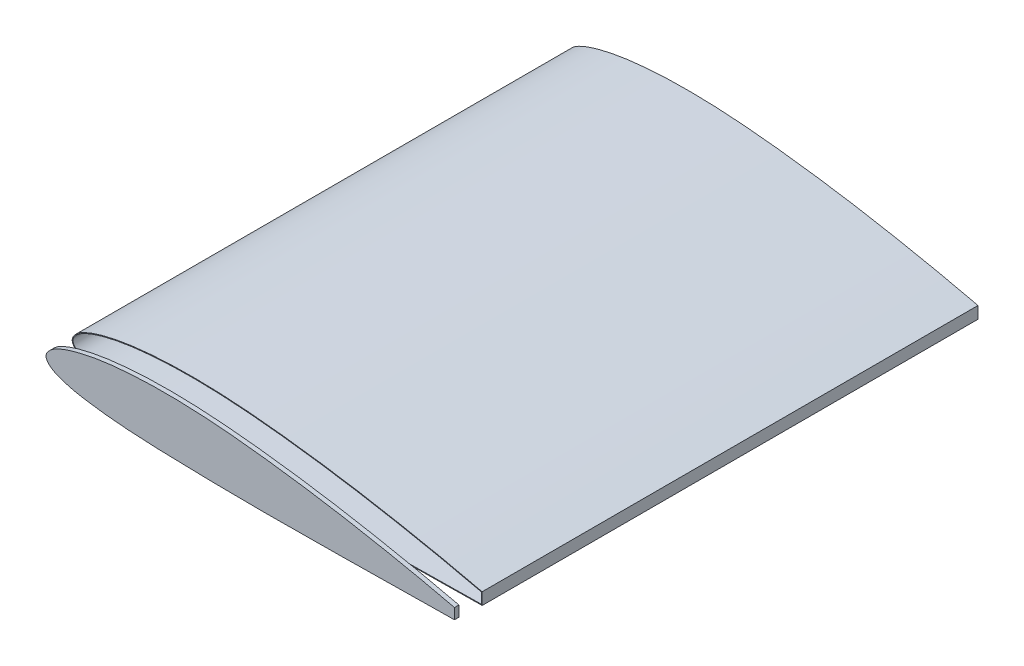
from build123d import *

# Parameters (mm, degrees)
CUT_EXTRUDE2_DEPTH      = 456.484616263
CUT_EXTRUDE2_DEPTH_BACK = 456.484616263
SKETCH12_W              = 30
SKETCH12_H              = 335.28
SHELL7_START            = 0.5
SHELL7_DEPTH            = 334.78
BOSS_EXTRUDE1_DEPTH     = 3


# Read off the part's stored shape, not the designer's step: Shell7
with BuildPart() as part:
    # Sketch3 → Loft1 section 0
    with BuildSketch(Plane.XY):
        with BuildLine():
            Line((304.402760331, -9.206309447), (307.244987748, -9.943633681))
            Line((307.244987748, -9.943633681), (304.361804056, -9.997689479))
            add(Edge.make_bspline(
                [(304.402760331, -9.206309447), (299.386393305, -7.904974812), (289.366834348, -5.305723396), (269.292243905, -0.455697423), (244.157418673, 5.067813383), (213.93952694, 11.002079852), (183.689202989, 16.212376808), (153.375306279, 20.449953668), (123.023879434, 23.827993752), (97.63872708, 25.447666722), (77.294499113, 25.657862147), (61.992767442, 25.215004112), (46.634606061, 24.054498874), (33.812510772, 22.310235655), (23.548958486, 20.117280617), (15.746504066, 18.044448787), (9.09525196, 15.503022528), (3.305842356, 12.304112273), (-1.897531204, 6.523191652), (2.90852328, 0.956438003), (8.287253401, -1.747431977), (14.665860328, -3.919971957), (22.247032639, -5.633346115), (32.352306183, -7.28367259), (44.993986957, -8.805622753), (60.209207882, -9.940944481), (75.434015323, -10.680394184), (95.75087408, -11.282701477), (121.162053183, -11.789584979), (151.674243405, -11.96213272), (182.199368639, -11.713734618), (212.733374887, -11.393730006), (243.273783293, -11.050843591), (268.724480055, -10.596509904), (289.088670203, -10.284040099), (299.270526365, -10.093144055), (304.361804056, -9.997689479)],
                knots=[0, 0, 0, 0, 0.02501249, 0.049959286, 0.099672925, 0.14920632, 0.198581097, 0.24780517, 0.296916575, 0.345952722, 0.370491626, 0.395091204, 0.419814796, 0.444798575, 0.457489819, 0.470406405, 0.483879409, 0.49126412, 0.503458853, 0.513609129, 0.520450991, 0.533235388, 0.545691039, 0.558031884, 0.582609167, 0.607134742, 0.63165208, 0.656174272, 0.705233949, 0.754320379, 0.803437364, 0.852566096, 0.901700994, 0.950848809, 0.975422717, 1, 1, 1, 1], degree=3))
        make_face()
    # Sketch4 → Loft1 section 1
    with BuildSketch(Plane.XY.offset(335.28)):
        with BuildLine():
            Line((304.361804056, -9.997689479), (307.244987748, -9.943633681))
            Line((307.244987748, -9.943633681), (304.402760331, -9.206309447))
            add(Edge.make_bspline(
                [(304.402760331, -9.206309447), (299.386393305, -7.904974812), (289.366834348, -5.305723396), (269.292243905, -0.455697423), (244.157418673, 5.067813383), (213.93952694, 11.002079852), (183.689202989, 16.212376808), (153.375306279, 20.449953668), (123.023879434, 23.827993752), (97.63872708, 25.447666722), (77.294499113, 25.657862147), (61.992767442, 25.215004112), (46.634606061, 24.054498874), (33.812510772, 22.310235655), (23.548958486, 20.117280617), (15.746504066, 18.044448787), (9.09525196, 15.503022528), (3.305842356, 12.304112273), (-1.897531204, 6.523191652), (2.90852328, 0.956438003), (8.287253401, -1.747431977), (14.665860328, -3.919971957), (22.247032639, -5.633346115), (32.352306183, -7.28367259), (44.993986957, -8.805622753), (60.209207882, -9.940944481), (75.434015323, -10.680394184), (95.75087408, -11.282701477), (121.162053183, -11.789584979), (151.674243405, -11.96213272), (182.199368639, -11.713734618), (212.733374887, -11.393730006), (243.273783293, -11.050843591), (268.724480055, -10.596509904), (289.088670203, -10.284040099), (299.270526365, -10.093144055), (304.361804056, -9.997689479)],
                knots=[0, 0, 0, 0, 0.02501249, 0.049959286, 0.099672925, 0.14920632, 0.198581097, 0.24780517, 0.296916575, 0.345952722, 0.370491626, 0.395091204, 0.419814796, 0.444798575, 0.457489819, 0.470406405, 0.483879409, 0.49126412, 0.503458853, 0.513609129, 0.520450991, 0.533235388, 0.545691039, 0.558031884, 0.582609167, 0.607134742, 0.63165208, 0.656174272, 0.705233949, 0.754320379, 0.803437364, 0.852566096, 0.901700994, 0.950848809, 0.975422717, 1, 1, 1, 1], degree=3))
        make_face()
    loft()

    # Sketch12 → Cut-Extrude2 (cut, two sides: drawn at the far end of the back side and taken through both)
    with BuildSketch(Plane(origin=(0, 0, 0), x_dir=(1, 0, 0), z_dir=(0, 1, 0)).offset(-CUT_EXTRUDE2_DEPTH_BACK)):
        with Locations((292.244987748, -167.64)):
            Rectangle(SKETCH12_W, SKETCH12_H)
    extrude(amount=CUT_EXTRUDE2_DEPTH + CUT_EXTRUDE2_DEPTH_BACK, mode=Mode.SUBTRACT)

    # Shell7 outline → Shell7 (cut)
    with BuildSketch(Plane.XY.offset(SHELL7_START)):
        with BuildLine():
            Line((276.7449878, -9.975467396), (276.744987767, -2.791972072))
            add(Edge.make_bspline(
                [(276.744987767, -2.791972072), (276.682381822, -2.77714937), (276.619774909, -2.762330556), (276.557167031, -2.747515623), (276.49455819, -2.732704564), (276.431948388, -2.717897371), (276.369337629, -2.703094037), (276.306725915, -2.688294555), (276.244113248, -2.673498916), (276.181499631, -2.658707113), (276.118885067, -2.64391914), (276.056269558, -2.629134989), (275.993653107, -2.614354651), (275.931035716, -2.599578121), (275.189834715, -2.424716171), (274.511146145, -2.265075559), (273.832352143, -2.105882969), (273.153453155, -1.947137816), (272.474449628, -1.788839507), (271.795341984, -1.630987447), (271.116130656, -1.473581036), (270.436816037, -1.316619668), (269.757398544, -1.160102735), (269.077878552, -1.004029623), (268.39825645, -0.848399714), (267.718532601, -0.693212386), (267.038707367, -0.538467013), (264.99892855, -0.075554861), (263.638667103, 0.231288694), (262.278004991, 0.536401658), (260.916951774, 0.839795721), (259.555513103, 1.141493569), (258.19369551, 1.441527482), (256.831509337, 1.739928213), (255.468966538, 2.036717327), (254.106075936, 2.331907333), (252.742840405, 2.625507782), (251.37925974, 2.917532273), (250.015338238, 3.208000767), (248.65108861, 3.496933953), (245.921936627, 4.071749126), (244.557033381, 4.357629703), (243.191832895, 4.642003994), (241.826246605, 4.924813259), (240.460451184, 5.206235641), (239.094283435, 5.486027554), (237.727761756, 5.764326773), (236.361016769, 6.041304748), (234.993981327, 6.316726392), (233.626583059, 6.590510755), (232.258937704, 6.862950098), (230.890967514, 7.133764038), (229.522707225, 7.403071115), (226.785580944, 7.938590141), (225.416711631, 8.204806415), (224.04756769, 8.469496385), (222.678050319, 8.732586822), (221.308352104, 8.994282318), (219.938295343, 9.254277055), (218.567891227, 9.512746065), (217.197285671, 9.769885929), (215.826414998, 10.025384779), (214.455185959, 10.279152077), (213.083712014, 10.53155744), (211.711944854, 10.782206542), (210.339880008, 11.031279107), (207.595176489, 11.526112837), (206.22253655, 11.771880072), (204.849605802, 12.015964787), (203.476381022, 12.258336251), (202.102858793, 12.498964571), (200.729035841, 12.737819683), (199.354909172, 12.974870662), (197.98047622, 13.210085335), (196.60573473, 13.443430214), (195.230682684, 13.674870736), (193.855317976, 13.904371816), (192.479638078, 14.131898718), (191.103639521, 14.357418229), (188.350995097, 14.804382072), (186.974339913, 15.025831314), (185.597439726, 15.245220441), (184.219833289, 15.462518684), (182.843076001, 15.677992099), (181.463512061, 15.890265362), (180.087368521, 16.103061286), (178.706905986, 16.309540968), (177.32912378, 16.518134565), (175.949387966, 16.721686702), (174.56998207, 16.924598778), (173.190095226, 17.124954953), (171.809938007, 17.323365929), (169.049031329, 17.716094107), (167.668283755, 17.910427758), (166.287251353, 18.102707442), (164.905921109, 18.293051584), (163.524336344, 18.481333013), (162.142467776, 18.667619112), (160.760306951, 18.852007871), (159.377903158, 19.034452005), (157.995272229, 19.214891124), (156.612361944, 19.393391138), (155.229173447, 19.569990139), (153.845800639, 19.744563486), (152.462125672, 19.917262054), (149.694362442, 20.258706043), (148.310259018, 20.427449501), (146.925937206, 20.594139591), (145.54137113, 20.758689017), (144.156572312, 20.921039557), (142.771542148, 21.081110982), (141.386260438, 21.238805222), (140.000710569, 21.39404361), (138.614897557, 21.546778783), (137.228834739, 21.696962956), (135.842517657, 21.84451358), (134.455928193, 21.98933842), (133.069077642, 22.13140762), (130.294847623, 22.409858269), (128.907468508, 22.546247633), (127.519830815, 22.679693669), (126.131912708, 22.810225231), (124.74375953, 22.937635502), (123.355336802, 23.061896697), (121.966620722, 23.183028436), (120.577654686, 23.300912397), (119.188468514, 23.415383727), (117.799021316, 23.526385321), (116.409294002, 23.633887203), (115.019359552, 23.737729841), (113.629161602, 23.837864675), (110.848296789, 24.030519303), (109.457628313, 24.123040472), (108.066724821, 24.211664691), (106.675601898, 24.296302576), (105.284266379, 24.376867532), (103.892719782, 24.453269113), (102.500966283, 24.525412901), (101.109015924, 24.593207247), (99.716882523, 24.656569588), (98.324580257, 24.715424021), (96.932123201, 24.769687259), (95.539528204, 24.819252246), (94.146813387, 24.863997246), (91.361131065, 24.943749754), (89.968170951, 24.978753029), (88.575081034, 25.008866448), (87.182009149, 25.033855176), (85.788617395, 25.054119462), (84.39555622, 25.068761697), (83.002092792, 25.078786239), (81.608742383, 25.083484342), (80.215683022, 25.082433377), (78.822054929, 25.076859354), (77.42903628, 25.065510238), (76.035841536, 25.048812032), (74.64281958, 25.026599003), (72.553498722, 24.984836089), (71.85709509, 24.969507989), (71.160731608, 24.952759909), (70.464411739, 24.934577807), (69.768138878, 24.914947364), (69.071916371, 24.893854652), (68.375747529, 24.87128655), (67.679635719, 24.847230901), (66.983584428, 24.821676426), (66.287597422, 24.794612382), (65.591678876, 24.766027968), (64.895833578, 24.735911479), (64.200067139, 24.704249214), (62.808705347, 24.637799032), (62.113111183, 24.603006939), (61.417595998, 24.566652447), (60.722198095, 24.528678398), (60.026886435, 24.489091914), (59.331657417, 24.447899903), (58.636548968, 24.4050733), (57.941586242, 24.360567025), (57.246753413, 24.314350501), (56.552031795, 24.266409449), (55.857449583, 24.216721974), (55.163047611, 24.16524848), (54.468772343, 24.111964085), (53.080540746, 24.00175962), (52.386578158, 23.944833558), (51.692794339, 23.886109889), (50.999141966, 23.825317603), (50.305607525, 23.763375904), (49.612872454, 23.69788499), (48.918421566, 23.633103608), (48.227527693, 23.56366104), (47.533087625, 23.494098489), (46.84177803, 23.421739471), (46.149227716, 23.347390593), (45.457358472, 23.271066755), (44.765722408, 23.192564466), (43.383068537, 23.031124655), (42.692050046, 22.948184555), (42.001347555, 22.862947058), (41.310993872, 22.775349228), (40.621003985, 22.685312831), (39.931383995, 22.592756263), (39.242147392, 22.497608355), (38.553319898, 22.399809391), (37.864932008, 22.299301402), (37.17700824, 22.19601812), (36.489564092, 22.089885149), (35.802615576, 21.980832618), (35.116192229, 21.868806139), (34.08738754, 21.696202486), (33.744584777, 21.637908026), (33.401976065, 21.578842228), (33.059301862, 21.519007128), (32.717293807, 21.458385927), (32.374619181, 21.396943144), (32.032861564, 21.334777304), (31.691114246, 21.271721939), (31.348844264, 21.207836639), (31.007822087, 21.143289415), (30.666170913, 21.077684845), (30.324984011, 21.011376135), (29.983882687, 20.944209499), (29.302007297, 20.808250857), (28.961224521, 20.739456194), (28.620610859, 20.669842666), (28.280130201, 20.599428637), (27.939822015, 20.528220242), (27.599705343, 20.456212392), (27.259757666, 20.383400317), (26.919963438, 20.309785693), (26.580343493, 20.235372933), (26.240922978, 20.16016157), (25.901684152, 20.084145429), (25.562592914, 20.007324396), (25.223696443, 19.929715667), (24.715615224, 19.812113581), (24.546310645, 19.772717118), (24.376942027, 19.733101959), (24.20814501, 19.693402936), (24.037781339, 19.653124492), (23.870867227, 19.613554265), (23.698908614, 19.57225401), (23.532376692, 19.532625913), (23.361872144, 19.491200817), (23.193642495, 19.450556495), (23.02460019, 19.409261208), (22.855870285, 19.367887341), (22.687165999, 19.326264263), (22.349906971, 19.242569549), (22.181348505, 19.200495218), (22.012862586, 19.158188471), (21.844450781, 19.115643886), (21.67611472, 19.072856065), (21.507856099, 19.029819634), (21.339676677, 18.986529239), (21.17157828, 18.942979549), (21.003562797, 18.899165257), (20.835632182, 18.855081076), (20.667788454, 18.810721744), (20.500033698, 18.76608202), (20.332370061, 18.721156685), (19.829659149, 18.585508263), (19.494887581, 18.493910643), (19.160515283, 18.401114849), (18.826544517, 18.307064591), (18.492984452, 18.211718026), (18.159854739, 18.11504403), (17.82717811, 18.017010512), (17.494973682, 17.917579478), (17.163255784, 17.816710374), (16.832038082, 17.714365965), (16.501339432, 17.610513552), (16.171186422, 17.505118692), (15.841607792, 17.398138831), (15.348123082, 17.235241053), (15.183776531, 17.180537256), (15.019580009, 17.125423737), (14.85553585, 17.069895907), (14.691646917, 17.013949464), (14.527916486, 16.957580141), (14.364348131, 16.90078353), (14.200945616, 16.843554971), (14.037712795, 16.785889505), (13.874653507, 16.727781907), (13.711771492, 16.669226771), (13.5490703, 16.610218673), (13.386553207, 16.550752403), (13.06189308, 16.430894109), (12.89975372, 16.370502785), (12.737790137, 16.309638627), (12.576044012, 16.248309708), (12.414492515, 16.186498604), (12.253121622, 16.124196289), (12.091953415, 16.061408536), (11.931014385, 15.998137153), (11.770305617, 15.934368472), (11.609814254, 15.87008494), (11.449546887, 15.805283667), (11.289527707, 15.739969553), (11.129745424, 15.674121395), (10.810677377, 15.541355282), (10.65137679, 15.474432425), (10.492471105, 15.40700743), (10.333102744, 15.338813154), (10.176357258, 15.270821165), (10.014403364, 15.200392886), (9.862089009, 15.132793102), (9.698061875, 15.060007288), (9.545962428, 14.991311687), (9.385386161, 14.918408314), (9.230119495, 14.847068426), (9.073041691, 14.774193592), (8.916759339, 14.700993251), (8.682854965, 14.590286119), (8.604976533, 14.553234968), (8.527242236, 14.516056547), (8.449427178, 14.478634868), (8.372143797, 14.44126882), (8.294311924, 14.403411377), (8.217169198, 14.365688305), (8.140040777, 14.327735817), (8.062496387, 14.289346615), (7.985889407, 14.251211174), (7.908770205, 14.212542962), (7.832002083, 14.173838424), (7.755354625, 14.134929998), (7.602361916, 14.056736764), (7.526013319, 14.017448694), (7.449845145, 13.977977822), (7.373768267, 13.938258452), (7.297971153, 13.898396702), (7.222265335, 13.858260411), (7.146707706, 13.817880542), (7.071435443, 13.777329521), (6.996317413, 13.736505647), (6.921296936, 13.695372731), (6.846595185, 13.654066781), (6.772072449, 13.612455435), (6.697716239, 13.570556089), (6.549404292, 13.486189673), (6.475443627, 13.443720608), (6.401676329, 13.40095986), (6.328121599, 13.357909376), (6.254768676, 13.314559097), (6.181620764, 13.270905642), (6.108695243, 13.226951071), (6.035997345, 13.182691243), (5.963515677, 13.138115196), (5.891249919, 13.09321844), (5.819229252, 13.048009856), (5.747470059, 13.002489464), (5.675908759, 12.956618449), (5.533262752, 12.864219576), (5.462170372, 12.817686745), (5.391317654, 12.770822976), (5.320699589, 12.723622176), (5.250322065, 12.676085065), (5.180193895, 12.628214023), (5.110318024, 12.580007683), (5.040692567, 12.531461791), (4.971318452, 12.482574089), (4.902204419, 12.433347248), (4.833361615, 12.383785043), (4.764789327, 12.33388322), (4.69647031, 12.283627624), (4.56036732, 12.182429116), (4.492576262, 12.131480581), (4.425097023, 12.080219565), (4.357713887, 12.028482299), (4.291034437, 11.976727544), (4.223944086, 11.924100821), (4.157794211, 11.871648889), (4.091750518, 11.818703552), (4.025448024, 11.765002579), (3.960414049, 11.711737082), (3.894809195, 11.657423015), (3.829902282, 11.60312226), (3.765227628, 11.548414813), (3.636548282, 11.438358309), (3.572538106, 11.383003883), (3.508840224, 11.327297834), (3.445546927, 11.271319159), (3.382493563, 11.214900078), (3.319879638, 11.158226371), (3.257644531, 11.101225532), (3.195675323, 11.043781085), (3.134132731, 10.986045444), (3.073056102, 10.92803979), (3.012221108, 10.869532013), (2.951858173, 10.810760923), (2.891901976, 10.751627311), (2.802605046, 10.662401372), (2.772945739, 10.632571642), (2.743393961, 10.602653706), (2.713950903, 10.572647114), (2.684617759, 10.54255141), (2.655395721, 10.512366142), (2.626285982, 10.482090856), (2.597289733, 10.4517251), (2.568408167, 10.421268419), (2.539642477, 10.390720361), (2.510993855, 10.360080471), (2.482463494, 10.329348297), (2.454052585, 10.298523386), (2.397472057, 10.236687181), (2.369298272, 10.205670998), (2.341279531, 10.174600613), (2.313258582, 10.143286529), (2.285641977, 10.112216172), (2.257766554, 10.080579221), (2.230284185, 10.049187181), (2.202992475, 10.017758333), (2.175506904, 9.985835666), (2.148430482, 9.954190597), (2.121400084, 9.922307483), (2.094518428, 9.890360131), (2.067788297, 9.858325812), (2.014621245, 9.794075263), (1.988185866, 9.761860172), (1.96190108, 9.729554732), (1.935769331, 9.697158412), (1.909793063, 9.664670681), (1.88397472, 9.632091006), (1.858316748, 9.599418856), (1.832821589, 9.5666537), (1.80749169, 9.533795006), (1.782329494, 9.500842242), (1.757337446, 9.467794877), (1.732517989, 9.434652378), (1.707873569, 9.401414215), (1.658939691, 9.334745497), (1.634651874, 9.301317343), (1.61053359, 9.267778147), (1.586621868, 9.234176136), (1.56286907, 9.200439366), (1.539301943, 9.166603493), (1.515949922, 9.132705808), (1.492784178, 9.098699377), (1.469782352, 9.064549687), (1.446985563, 9.030314903), (1.42442349, 8.996031614), (1.402042112, 8.96161175), (1.379881397, 8.927113479), (1.335985835, 8.857923601), (1.314252405, 8.823234384), (1.292736751, 8.788450946), (1.271442276, 8.753573329), (1.250372361, 8.718601566), (1.229530367, 8.683535676), (1.208919633, 8.648375666), (1.188543477, 8.613121533), (1.168405197, 8.577773259), (1.148508069, 8.542330816), (1.128855349, 8.506794165), (1.109450269, 8.471163251), (1.090296043, 8.435438012), (1.061945772, 8.381708549), (1.052559207, 8.363775139), (1.043236559, 8.345818121), (1.033978219, 8.327837477), (1.024784579, 8.309833186), (1.015656029, 8.29180523), (1.006592961, 8.27375359), (0.997595767, 8.255678246), (0.988664837, 8.237579181), (0.979800562, 8.219456374), (0.971003335, 8.201309806), (0.962273546, 8.18313946), (0.953611586, 8.164945315), (0.936424108, 8.128509389), (0.927898549, 8.110267741), (0.919442879, 8.092004355), (0.911052814, 8.073710201), (0.902731414, 8.055391333), (0.894484336, 8.037058463), (0.886313927, 8.018714839), (0.87821848, 8.000355158), (0.870195883, 7.981973537), (0.862247354, 7.963571377), (0.854377011, 7.945156194), (0.846586567, 7.926730165), (0.838871599, 7.908282314), (0.815966275, 7.852897823), (0.801012224, 7.815913007), (0.786380591, 7.778868885), (0.772077559, 7.741767922), (0.758109235, 7.704612524), (0.744481652, 7.667405044), (0.731200771, 7.630147778), (0.718272479, 7.592842968), (0.70570259, 7.555492801), (0.693496844, 7.518099407), (0.681660907, 7.480664863), (0.670200372, 7.443191189), (0.65912076, 7.40568035), (0.643080894, 7.34936121), (0.637830908, 7.330579407), (0.632678216, 7.311789039), (0.627623476, 7.292990295), (0.622667346, 7.274183367), (0.617810484, 7.255368446), (0.613053547, 7.236545722), (0.608397195, 7.217715386), (0.603842085, 7.198877629), (0.599388875, 7.18003264), (0.595038223, 7.161180612), (0.590790786, 7.142321735), (0.586647224, 7.123456199), (0.578569163, 7.085712191), (0.574635388, 7.066838149), (0.57080324, 7.047935364), (0.567079844, 7.0290556), (0.563474426, 7.010207766), (0.559953049, 6.991244292), (0.556535013, 6.97226644), (0.553241722, 6.953363784), (0.550045452, 6.934401757), (0.546940605, 6.915361095), (0.543964685, 6.896415433), (0.541080592, 6.877386735), (0.538308554, 6.858372251), (0.530312092, 6.801288567), (0.525410396, 6.76319414), (0.520940738, 6.725068797), (0.51690581, 6.686920204), (0.513308246, 6.648755971), (0.510150615, 6.610583651), (0.507435426, 6.572410744), (0.505165125, 6.534244691), (0.503342096, 6.496092878), (0.501968659, 6.457962635), (0.501047076, 6.419861237), (0.500579542, 6.381795901), (0.500568193, 6.343773791), (0.501238558, 6.286816124), (0.501576612, 6.267842869), (0.502029511, 6.248883097), (0.502597501, 6.229937659), (0.503280828, 6.211007403), (0.504079736, 6.192093179), (0.504994472, 6.173195838), (0.506025282, 6.154316228), (0.50717241, 6.135455199), (0.508436103, 6.1166136), (0.509816606, 6.097792282), (0.511314166, 6.078992094), (0.512929026, 6.060213885), (0.515527638, 6.032080815), (0.516423093, 6.022710305), (0.51734899, 6.013334528), (0.518300991, 6.00399827), (0.519287295, 5.994621948), (0.520302124, 5.985258499), (0.521341192, 5.975951507), (0.522411799, 5.966635509), (0.523518827, 5.95726243), (0.524654506, 5.947900363), (0.525814489, 5.938590058), (0.527010885, 5.929221944), (0.528234466, 5.919877003), (0.530742392, 5.901175961), (0.53202625, 5.891824129), (0.533339915, 5.882471039), (0.5346833, 5.873116744), (0.536056317, 5.863761299), (0.537458878, 5.854404755), (0.538890895, 5.845047168), (0.540352282, 5.83568859), (0.541842949, 5.826329075), (0.543362809, 5.816968677), (0.544911775, 5.807607448), (0.546489759, 5.798245443), (0.548096673, 5.788882714), (0.556275455, 5.742065723), (0.563279879, 5.7046014), (0.57073999, 5.667130198), (0.578649965, 5.629656077), (0.587003865, 5.592183111), (0.595795642, 5.554715487), (0.605019133, 5.5172575), (0.614668064, 5.479813562), (0.624736045, 5.442388192), (0.635216576, 5.404986025), (0.646103044, 5.367611806), (0.657388722, 5.330270391), (0.669066772, 5.292966751), (0.687161977, 5.237075572), (0.693290136, 5.218455833), (0.699513816, 5.19984738), (0.70583211, 5.181250844), (0.712244115, 5.162666856), (0.718748925, 5.144096049), (0.725345636, 5.125539053), (0.732033342, 5.106996501), (0.738811139, 5.088469023), (0.745678122, 5.069957251), (0.752633386, 5.051461817), (0.759676026, 5.032983353), (0.766805138, 5.01452249), (0.781234495, 4.977637228), (0.788533809, 4.959215057), (0.795920326, 4.940805211), (0.803389881, 4.922415999), (0.810939, 4.904054487), (0.818566769, 4.885721869), (0.826273933, 4.867415428), (0.834061239, 4.849132345), (0.841928356, 4.830872249), (0.849873937, 4.812637131), (0.857896691, 4.794428905), (0.865996605, 4.776246585), (0.874174718, 4.758086747), (0.898937953, 4.703684338), (0.915753519, 4.667515382), (0.932872222, 4.631445501), (0.950290425, 4.595474484), (0.968004456, 4.559602152), (0.986010613, 4.523828356), (1.00430516, 4.488152979), (1.022884328, 4.452575933), (1.041744317, 4.417097162), (1.060881294, 4.381716642), (1.080291394, 4.346434376), (1.099970718, 4.311250403), (1.119915335, 4.276164789), (1.160327233, 4.206190475), (1.180795569, 4.171299601), (1.201510324, 4.136528284), (1.222531923, 4.101757201), (1.24364515, 4.067363926), (1.265300746, 4.032561939), (1.286864863, 3.998405435), (1.308780131, 3.964182389), (1.331202846, 3.929592935), (1.353361565, 3.895893934), (1.376114099, 3.861719336), (1.398916989, 3.827912247), (1.42197828, 3.794147859), (1.468514653, 3.726852892), (1.491995141, 3.693314313), (1.515685112, 3.659884476), (1.53958175, 3.626563218), (1.563682236, 3.593350376), (1.587983752, 3.560245787), (1.612483481, 3.527249288), (1.637178605, 3.494360716), (1.662066306, 3.461579909), (1.687143766, 3.428906704), (1.712408169, 3.396340937), (1.737856695, 3.363882446), (1.763486527, 3.331531068), (1.815103168, 3.267042211), (1.841089933, 3.234904197), (1.867248556, 3.202880893), (1.89360694, 3.170918326), (1.92003126, 3.139215916), (1.946855629, 3.107301562), (1.973539442, 3.075881757), (2.000527217, 3.044408031), (2.027900691, 3.012734625), (2.054950327, 2.981759196), (2.082531273, 2.950436526), (2.110079426, 2.919438683), (2.137820132, 2.888498002), (2.193576401, 2.82685564), (2.221597925, 2.796147083), (2.24976151, 2.765550682), (2.278065827, 2.735065966), (2.306509547, 2.704692466), (2.335091341, 2.674429713), (2.363809879, 2.644277235), (2.392663833, 2.614234565), (2.421651873, 2.584301232), (2.450772671, 2.554476767), (2.480024897, 2.5247607), (2.509407222, 2.495152561), (2.538918318, 2.465651881), (2.598195392, 2.406864499), (2.627957722, 2.377581317), (2.657871516, 2.34838017), (2.687830232, 2.31936127), (2.718047206, 2.290321033), (2.748281897, 2.261481041), (2.778602594, 2.232781711), (2.809173399, 2.204066129), (2.83982569, 2.175481706), (2.870474568, 2.147111598), (2.901358056, 2.118743527), (2.932287362, 2.090538318), (2.963341359, 2.062430511), (3.056818616, 1.978444333), (3.119565052, 1.922897187), (3.182733452, 1.86779491), (3.246317598, 1.813138532), (3.310311222, 1.758929055), (3.374707941, 1.705167573), (3.439501239, 1.651855313), (3.504684512, 1.59899361), (3.570251162, 1.546583812), (3.636194761, 1.494627125), (3.702509253, 1.443124371), (3.76918923, 1.392075698), (3.836230253, 1.341480207), (3.937328728, 1.266263168), (3.971117459, 1.241303759), (4.004994798, 1.216457228), (4.038960114, 1.191723516), (4.073012775, 1.167102565), (4.107152151, 1.142594314), (4.141377611, 1.118198705), (4.175688522, 1.09391568), (4.210084254, 1.069745178), (4.244564176, 1.045687142), (4.279127656, 1.021741512), (4.313774063, 0.997908229), (4.348502766, 0.974187233), (4.418123502, 0.926969701), (4.453014201, 0.903474221), (4.487992994, 0.880085491), (4.523038256, 0.856819049), (4.558170735, 0.833659798), (4.593393397, 0.810604332), (4.628685773, 0.787666262), (4.664040076, 0.764851472), (4.699476805, 0.742146124), (4.735015587, 0.719535366), (4.770640173, 0.697027611), (4.806322614, 0.67464016), (4.842098432, 0.652349411), (4.949652321, 0.585796734), (5.021660476, 0.541852001), (5.094056677, 0.498273488), (5.166357005, 0.455332279), (5.24019316, 0.41208091), (5.31152378, 0.370811126), (5.387792354, 0.327325776), (5.45844824, 0.287462088), (5.534944891, 0.24499051), (5.607854269, 0.204879835), (5.682789205, 0.164280401), (5.757485679, 0.124257269), (5.832521532, 0.08454109), (5.983077708, 0.005772706), (6.058598431, -0.033279), (6.134409198, -0.072032743), (6.210270383, -0.110399334), (6.286779619, -0.148644485), (6.362907136, -0.186360757), (6.439717063, -0.223973883), (6.516753917, -0.261355601), (6.593477683, -0.298273885), (6.670978039, -0.335144514), (6.748387697, -0.37173735), (6.825976572, -0.408068211), (6.903739306, -0.444194181), (7.020605695, -0.498056232), (7.059599252, -0.515956537), (7.09863035, -0.533804168), (7.137698435, -0.551600161), (7.176802953, -0.569345556), (7.215943349, -0.58704139), (7.25511907, -0.6046887), (7.294329563, -0.622288524), (7.333574271, -0.639841899), (7.372852643, -0.657349865), (7.412164124, -0.674813457), (7.451508161, -0.692233714), (7.490884198, -0.709611674), (7.569699166, -0.744285074), (7.609131052, -0.761577549), (7.648650559, -0.778853549), (7.687987385, -0.796002657), (7.727824488, -0.813303119), (7.76706869, -0.830325487), (7.806727798, -0.84744629), (7.846570857, -0.86461031), (7.885958229, -0.881560041), (7.925720528, -0.898581136), (7.965362793, -0.91553567), (8.005044076, -0.932446861), (8.04474391, -0.949323147), (8.163890736, -0.999831955), (8.24338849, -1.033347405), (8.32295379, -1.066707041), (8.402584498, -1.099909525), (8.482280064, -1.132954537), (8.562041395, -1.165842913), (8.641869066, -1.198575479), (8.72176206, -1.231152062), (8.801718082, -1.263571493), (8.881735487, -1.2958327), (8.961815684, -1.327936322), (9.041963889, -1.359885585), (9.122184962, -1.391684475), (9.282755008, -1.454976668), (9.363106323, -1.486470844), (9.443523231, -1.517814073), (9.524005029, -1.549007333), (9.604551018, -1.580051598), (9.685160497, -1.610947844), (9.765832765, -1.641697047), (9.846567122, -1.672300183), (9.927362866, -1.702758227), (10.008219297, -1.733072155), (10.089135715, -1.763242942), (10.170111418, -1.793271565), (10.251145707, -1.823158999), (10.65660657, -1.9718951), (10.981910852, -2.088639401), (11.308023972, -2.203225426), (11.635171559, -2.315523922), (11.96308458, -2.426451951), (12.290545179, -2.533769332), (12.621865305, -2.641460223), (12.949292131, -2.744745691), (13.281869496, -2.847989112), (13.612058878, -2.948457806), (13.944213104, -3.04745917), (14.276524709, -3.144623196), (14.609470408, -3.240081458), (15.276409031, -3.427641572), (15.610416203, -3.519747651), (15.944871962, -3.610191757), (16.280050919, -3.699116657), (16.615212708, -3.786367827), (16.951301619, -3.872207847), (17.287540478, -3.956415952), (17.624171228, -4.039202659), (17.96148655, -4.120650361), (18.298720423, -4.200458914), (18.636736578, -4.279071175), (18.974906856, -4.356271827), (19.313479929, -4.432195894), (19.991271066, -4.581525791), (20.330498485, -4.654937021), (20.67002222, -4.727107647), (21.009928436, -4.798166684), (21.349946798, -4.867982413), (21.690393846, -4.936759305), (22.031112662, -5.004492321), (22.371911016, -5.071101033), (22.713075393, -5.13673784), (23.054602898, -5.201499367), (23.396050976, -5.265242639), (23.737896732, -5.328110485), (24.0798737, -5.390089924), (24.764222875, -5.512340898), (25.106585617, -5.572612371), (25.449128708, -5.632055817), (25.791845601, -5.690698805), (26.134730341, -5.748569893), (26.477777061, -5.805698139), (26.820979656, -5.862112698), (27.164331624, -5.917842526), (27.50782608, -5.972916169), (27.851455945, -6.02736165), (28.195214304, -6.081206455), (28.539094935, -6.134477611), (28.883093011, -6.187201858), (29.399262456, -6.265507949), (29.571345374, -6.291478706), (29.743471044, -6.317330443), (29.915579006, -6.343042318), (30.08776923, -6.368646945), (30.259990865, -6.394144632), (30.432176219, -6.419518127), (30.604371894, -6.44476893), (30.776632585, -6.469908822), (30.948906724, -6.494934649), (31.121151211, -6.519837691), (31.293459261, -6.544628601), (31.465764581, -6.569302124), (31.810416051, -6.618417667), (31.98275862, -6.642859459), (32.15511802, -6.667185456), (32.327494235, -6.691395862), (32.499887234, -6.715490899), (32.672296975, -6.739470804), (32.844723394, -6.763335835), (33.017166425, -6.787086266), (33.189625975, -6.81072239), (33.36210195, -6.834244516), (33.534594231, -6.857652973), (33.707102691, -6.880948105), (33.879627188, -6.904130276), (34.742329074, -7.019478232), (35.432746685, -7.109955942), (36.12340462, -7.198645308), (36.814308726, -7.285575552), (37.505447177, -7.370768635), (38.19680239, -7.454240232), (38.888365752, -7.536005734), (39.580137974, -7.616082593), (40.272118437, -7.694488264), (40.964296401, -7.771237327), (41.656655807, -7.846342224), (42.34919321, -7.919819279), (43.041925536, -7.991695432), (44.42773544, -8.132307083), (45.120812784, -8.201042311), (45.814073125, -8.268220878), (46.507482274, -8.33389993), (47.201040661, -8.398071572), (47.894759723, -8.460748729), (48.58863838, -8.521987749), (49.282663627, -8.581846301), (49.976823286, -8.640351203), (50.671113153, -8.697517591), (51.365532001, -8.753388693), (52.060073067, -8.808025091), (52.754726701, -8.86143412), (54.144258661, -8.965894992), (54.839130702, -9.016942371), (55.534146673, -9.066858076), (56.229146176, -9.115633115), (56.924443805, -9.163365715), (57.619680067, -9.210066892), (58.314958812, -9.255742206), (59.0104948, -9.300448785), (59.706025729, -9.344225754), (60.401496736, -9.387063956), (61.097293945, -9.429004948), (61.792987822, -9.470158868), (62.488780259, -9.510432852), (63.880463053, -9.5893182), (64.576359077, -9.62792413), (65.272305795, -9.665704128), (65.968302011, -9.702666773), (66.664347565, -9.738821283), (67.360442272, -9.774178844), (68.056585412, -9.808752768), (68.752775604, -9.842557867), (69.449010979, -9.87560942), (70.145289476, -9.907922129), (70.841609177, -9.939509428), (71.537968518, -9.970383547), (72.234366277, -10.000556701), (73.627236096, -10.059530884), (74.323704262, -10.088332094), (75.020224922, -10.116452637), (75.716759684, -10.143931318), (76.413322604, -10.170749457), (77.10993438, -10.196912051), (77.806592649, -10.222464419), (78.503283452, -10.247449599), (79.200002302, -10.271879748), (79.896756053, -10.295758436), (80.593546714, -10.319119487), (81.290364768, -10.342011366), (81.987210287, -10.364423679), (83.380958057, -10.408363333), (84.077856986, -10.429885814), (84.774802178, -10.451001074), (85.471709944, -10.471668114), (86.168759138, -10.492036426), (86.865718241, -10.511986662), (87.562707357, -10.531582859), (88.259845012, -10.550948495), (88.956898862, -10.570005318), (89.653889576, -10.58872259), (90.351142263, -10.607286197), (91.048220431, -10.625638255), (91.745360172, -10.643750081), (93.836774713, -10.697423734), (95.231074023, -10.732307459), (96.625394762, -10.766298216), (98.019735533, -10.799389998), (99.41409543, -10.831573499), (100.808474085, -10.862840671), (102.202871458, -10.893186308), (103.59728756, -10.922607553), (104.991722106, -10.951102236), (106.386174345, -10.978666949), (107.780643039, -11.005295757), (109.175126816, -11.030980454), (110.569624932, -11.055713269), (113.358652243, -11.103272578), (114.753180984, -11.126096208), (116.147723694, -11.147964878), (117.542279463, -11.168871083), (118.936847806, -11.188806221), (120.331428629, -11.207764391), (121.726021993, -11.225743391), (123.120627845, -11.242743851), (124.515245732, -11.258767392), (125.909874708, -11.273814718), (127.304513421, -11.287884553), (128.699160598, -11.30097433), (130.093815933, -11.313083526), (132.883147163, -11.335357618), (134.27781971, -11.345518221), (135.672511751, -11.354726871), (137.067191705, -11.362950375), (138.461887214, -11.370213644), (139.856605002, -11.376543061), (141.2513196, -11.381932472), (142.646018022, -11.386360372), (144.040720384, -11.389819571), (145.435444811, -11.392320746), (146.830166818, -11.393866761), (148.224855779, -11.39443366), (149.619572124, -11.39400481), (152.409019539, -11.391305012), (153.803752752, -11.389029349), (155.198491342, -11.385839647), (156.59324602, -11.381808185), (157.988002822, -11.376945259), (159.382758365, -11.3712595), (160.777525114, -11.364794164), (162.172311394, -11.357610678), (163.567109784, -11.349759385), (164.961909738, -11.341274452), (166.356716452, -11.332193064), (167.751542458, -11.322566068), (169.146371805, -11.312436078), (171.936054022, -11.291258663), (173.330903423, -11.280219906), (174.725772611, -11.268706595), (176.120641194, -11.257017832), (177.515498916, -11.244680328), (178.9104394, -11.23228577), (180.305358808, -11.21978691), (181.700208866, -11.206830053), (183.095126529, -11.193708484), (184.490093493, -11.180603823), (185.884946307, -11.167092227), (187.27991617, -11.153616173), (188.674836689, -11.139985209), (191.46468983, -11.112491968), (192.859616072, -11.098631586), (194.254534621, -11.08462706), (195.649466023, -11.070538021), (197.044386754, -11.056325682), (198.439293612, -11.041958508), (199.834209178, -11.02746026), (201.2291437, -11.012870542), (202.624079093, -10.998199508), (204.018999368, -10.983436575), (205.413924273, -10.96859477), (206.808878273, -10.953714572), (208.203810642, -10.938790826), (210.993675651, -10.908809936), (212.388605414, -10.893751809), (213.783532129, -10.878644996), (215.178450541, -10.863426207), (216.573372493, -10.848122758), (217.968296996, -10.832757176), (219.363210061, -10.817299736), (220.758104643, -10.801700992), (222.152989286, -10.785934699), (223.547874007, -10.769996416), (224.942752218, -10.753868502), (226.337610854, -10.737512175), (227.732465758, -10.720915773), (230.522150627, -10.687183117), (231.916986286, -10.670040415), (233.311785933, -10.652658001), (234.706635819, -10.634776648), (236.101407094, -10.616877946), (237.496164479, -10.598343349), (238.890966375, -10.579337884), (240.285748971, -10.5602251), (241.680482374, -10.540591131), (243.075240941, -10.52034629), (244.470023321, -10.500084892), (245.86470741, -10.479067742), (247.259456922, -10.457740429), (250.048951739, -10.414356839), (251.443708985, -10.392310776), (252.838469191, -10.369957241), (254.233242849, -10.347329776), (255.628031168, -10.324481991), (257.022828503, -10.301468878), (258.417630625, -10.278328874), (259.812438475, -10.255084752), (261.207255875, -10.231758649), (262.602085024, -10.208385676), (263.996924635, -10.185011669), (265.39177332, -10.161673637), (266.786634207, -10.138386395), (268.793169777, -10.105026476), (269.404838377, -10.094875639), (270.016489665, -10.084744094), (270.628192287, -10.074637077), (271.239837881, -10.064561997), (271.851505212, -10.05450495), (272.463210114, -10.044482957), (273.074886216, -10.034508954), (273.686545715, -10.024563197), (274.298240771, -10.014644167), (274.909939365, -10.004787418), (275.521628898, -9.994981548), (276.133311144, -9.985211226), (276.7449878, -9.975467396)],
                knots=[0.045433155, 0.045433155, 0.045433155, 0.045433155, 0.045433155, 0.045433155, 0.045433155, 0.045433155, 0.045433155, 0.045433155, 0.045433155, 0.045433155, 0.045433155, 0.045433155, 0.045433155, 0.046875, 0.046875, 0.046875, 0.046875, 0.046875, 0.046875, 0.046875, 0.046875, 0.046875, 0.046875, 0.046875, 0.046875, 0.046875, 0.0625, 0.0625, 0.0625, 0.0625, 0.0625, 0.0625, 0.0625, 0.0625, 0.0625, 0.0625, 0.0625, 0.0625, 0.0625, 0.09375, 0.09375, 0.09375, 0.09375, 0.09375, 0.09375, 0.09375, 0.09375, 0.09375, 0.09375, 0.09375, 0.09375, 0.09375, 0.125, 0.125, 0.125, 0.125, 0.125, 0.125, 0.125, 0.125, 0.125, 0.125, 0.125, 0.125, 0.125, 0.15625, 0.15625, 0.15625, 0.15625, 0.15625, 0.15625, 0.15625, 0.15625, 0.15625, 0.15625, 0.15625, 0.15625, 0.15625, 0.1875, 0.1875, 0.1875, 0.1875, 0.1875, 0.1875, 0.1875, 0.1875, 0.1875, 0.1875, 0.1875, 0.1875, 0.1875, 0.21875, 0.21875, 0.21875, 0.21875, 0.21875, 0.21875, 0.21875, 0.21875, 0.21875, 0.21875, 0.21875, 0.21875, 0.21875, 0.25, 0.25, 0.25, 0.25, 0.25, 0.25, 0.25, 0.25, 0.25, 0.25, 0.25, 0.25, 0.25, 0.28125, 0.28125, 0.28125, 0.28125, 0.28125, 0.28125, 0.28125, 0.28125, 0.28125, 0.28125, 0.28125, 0.28125, 0.28125, 0.3125, 0.3125, 0.3125, 0.3125, 0.3125, 0.3125, 0.3125, 0.3125, 0.3125, 0.3125, 0.3125, 0.3125, 0.3125, 0.34375, 0.34375, 0.34375, 0.34375, 0.34375, 0.34375, 0.34375, 0.34375, 0.34375, 0.34375, 0.34375, 0.34375, 0.34375, 0.375, 0.375, 0.375, 0.375, 0.375, 0.375, 0.375, 0.375, 0.375, 0.375, 0.375, 0.375, 0.375, 0.390625, 0.390625, 0.390625, 0.390625, 0.390625, 0.390625, 0.390625, 0.390625, 0.390625, 0.390625, 0.390625, 0.390625, 0.390625, 0.40625, 0.40625, 0.40625, 0.40625, 0.40625, 0.40625, 0.40625, 0.40625, 0.40625, 0.40625, 0.40625, 0.40625, 0.40625, 0.421875, 0.421875, 0.421875, 0.421875, 0.421875, 0.421875, 0.421875, 0.421875, 0.421875, 0.421875, 0.421875, 0.421875, 0.421875, 0.4375, 0.4375, 0.4375, 0.4375, 0.4375, 0.4375, 0.4375, 0.4375, 0.4375, 0.4375, 0.4375, 0.4375, 0.4375, 0.4453125, 0.4453125, 0.4453125, 0.4453125, 0.4453125, 0.4453125, 0.4453125, 0.4453125, 0.4453125, 0.4453125, 0.4453125, 0.4453125, 0.4453125, 0.453125, 0.453125, 0.453125, 0.453125, 0.453125, 0.453125, 0.453125, 0.453125, 0.453125, 0.453125, 0.453125, 0.453125, 0.453125, 0.45703125, 0.45703125, 0.45703125, 0.45703125, 0.45703125, 0.45703125, 0.45703125, 0.45703125, 0.45703125, 0.45703125, 0.45703125, 0.45703125, 0.45703125, 0.4609375, 0.4609375, 0.4609375, 0.4609375, 0.4609375, 0.4609375, 0.4609375, 0.4609375, 0.4609375, 0.4609375, 0.4609375, 0.4609375, 0.4609375, 0.46875, 0.46875, 0.46875, 0.46875, 0.46875, 0.46875, 0.46875, 0.46875, 0.46875, 0.46875, 0.46875, 0.46875, 0.46875, 0.47265625, 0.47265625, 0.47265625, 0.47265625, 0.47265625, 0.47265625, 0.47265625, 0.47265625, 0.47265625, 0.47265625, 0.47265625, 0.47265625, 0.47265625, 0.4765625, 0.4765625, 0.4765625, 0.4765625, 0.4765625, 0.4765625, 0.4765625, 0.4765625, 0.4765625, 0.4765625, 0.4765625, 0.4765625, 0.4765625, 0.48046875, 0.48046875, 0.48046875, 0.48046875, 0.48046875, 0.48046875, 0.48046875, 0.48046875, 0.48046875, 0.48046875, 0.48046875, 0.48046875, 0.48046875, 0.482421875, 0.482421875, 0.482421875, 0.482421875, 0.482421875, 0.482421875, 0.482421875, 0.482421875, 0.482421875, 0.482421875, 0.482421875, 0.482421875, 0.482421875, 0.484375, 0.484375, 0.484375, 0.484375, 0.484375, 0.484375, 0.484375, 0.484375, 0.484375, 0.484375, 0.484375, 0.484375, 0.484375, 0.486328125, 0.486328125, 0.486328125, 0.486328125, 0.486328125, 0.486328125, 0.486328125, 0.486328125, 0.486328125, 0.486328125, 0.486328125, 0.486328125, 0.486328125, 0.48828125, 0.48828125, 0.48828125, 0.48828125, 0.48828125, 0.48828125, 0.48828125, 0.48828125, 0.48828125, 0.48828125, 0.48828125, 0.48828125, 0.48828125, 0.490234375, 0.490234375, 0.490234375, 0.490234375, 0.490234375, 0.490234375, 0.490234375, 0.490234375, 0.490234375, 0.490234375, 0.490234375, 0.490234375, 0.490234375, 0.4921875, 0.4921875, 0.4921875, 0.4921875, 0.4921875, 0.4921875, 0.4921875, 0.4921875, 0.4921875, 0.4921875, 0.4921875, 0.4921875, 0.4921875, 0.493164062, 0.493164062, 0.493164062, 0.493164062, 0.493164062, 0.493164062, 0.493164062, 0.493164062, 0.493164062, 0.493164062, 0.493164062, 0.493164062, 0.493164062, 0.494140625, 0.494140625, 0.494140625, 0.494140625, 0.494140625, 0.494140625, 0.494140625, 0.494140625, 0.494140625, 0.494140625, 0.494140625, 0.494140625, 0.494140625, 0.495117188, 0.495117188, 0.495117188, 0.495117188, 0.495117188, 0.495117188, 0.495117188, 0.495117188, 0.495117188, 0.495117188, 0.495117188, 0.495117188, 0.495117188, 0.49609375, 0.49609375, 0.49609375, 0.49609375, 0.49609375, 0.49609375, 0.49609375, 0.49609375, 0.49609375, 0.49609375, 0.49609375, 0.49609375, 0.49609375, 0.497070312, 0.497070312, 0.497070312, 0.497070312, 0.497070312, 0.497070312, 0.497070312, 0.497070312, 0.497070312, 0.497070312, 0.497070312, 0.497070312, 0.497070312, 0.497558594, 0.497558594, 0.497558594, 0.497558594, 0.497558594, 0.497558594, 0.497558594, 0.497558594, 0.497558594, 0.497558594, 0.497558594, 0.497558594, 0.497558594, 0.498046875, 0.498046875, 0.498046875, 0.498046875, 0.498046875, 0.498046875, 0.498046875, 0.498046875, 0.498046875, 0.498046875, 0.498046875, 0.498046875, 0.498046875, 0.499023438, 0.499023438, 0.499023438, 0.499023438, 0.499023438, 0.499023438, 0.499023438, 0.499023438, 0.499023438, 0.499023438, 0.499023438, 0.499023438, 0.499023438, 0.499511719, 0.499511719, 0.499511719, 0.499511719, 0.499511719, 0.499511719, 0.499511719, 0.499511719, 0.499511719, 0.499511719, 0.499511719, 0.499511719, 0.499511719, 0.5, 0.5, 0.5, 0.5, 0.5, 0.5, 0.5, 0.5, 0.5, 0.5, 0.5, 0.5, 0.5, 0.500976562, 0.500976562, 0.500976562, 0.500976562, 0.500976562, 0.500976562, 0.500976562, 0.500976562, 0.500976562, 0.500976562, 0.500976562, 0.500976562, 0.500976562, 0.501464844, 0.501464844, 0.501464844, 0.501464844, 0.501464844, 0.501464844, 0.501464844, 0.501464844, 0.501464844, 0.501464844, 0.501464844, 0.501464844, 0.501464844, 0.501708984, 0.501708984, 0.501708984, 0.501708984, 0.501708984, 0.501708984, 0.501708984, 0.501708984, 0.501708984, 0.501708984, 0.501708984, 0.501708984, 0.501708984, 0.501953125, 0.501953125, 0.501953125, 0.501953125, 0.501953125, 0.501953125, 0.501953125, 0.501953125, 0.501953125, 0.501953125, 0.501953125, 0.501953125, 0.501953125, 0.502929688, 0.502929688, 0.502929688, 0.502929688, 0.502929688, 0.502929688, 0.502929688, 0.502929688, 0.502929688, 0.502929688, 0.502929688, 0.502929688, 0.502929688, 0.503417969, 0.503417969, 0.503417969, 0.503417969, 0.503417969, 0.503417969, 0.503417969, 0.503417969, 0.503417969, 0.503417969, 0.503417969, 0.503417969, 0.503417969, 0.50390625, 0.50390625, 0.50390625, 0.50390625, 0.50390625, 0.50390625, 0.50390625, 0.50390625, 0.50390625, 0.50390625, 0.50390625, 0.50390625, 0.50390625, 0.504882812, 0.504882812, 0.504882812, 0.504882812, 0.504882812, 0.504882812, 0.504882812, 0.504882812, 0.504882812, 0.504882812, 0.504882812, 0.504882812, 0.504882812, 0.505859375, 0.505859375, 0.505859375, 0.505859375, 0.505859375, 0.505859375, 0.505859375, 0.505859375, 0.505859375, 0.505859375, 0.505859375, 0.505859375, 0.505859375, 0.506835938, 0.506835938, 0.506835938, 0.506835938, 0.506835938, 0.506835938, 0.506835938, 0.506835938, 0.506835938, 0.506835938, 0.506835938, 0.506835938, 0.506835938, 0.5078125, 0.5078125, 0.5078125, 0.5078125, 0.5078125, 0.5078125, 0.5078125, 0.5078125, 0.5078125, 0.5078125, 0.5078125, 0.5078125, 0.5078125, 0.508789062, 0.508789062, 0.508789062, 0.508789062, 0.508789062, 0.508789062, 0.508789062, 0.508789062, 0.508789062, 0.508789062, 0.508789062, 0.508789062, 0.508789062, 0.509765625, 0.509765625, 0.509765625, 0.509765625, 0.509765625, 0.509765625, 0.509765625, 0.509765625, 0.509765625, 0.509765625, 0.509765625, 0.509765625, 0.509765625, 0.51171875, 0.51171875, 0.51171875, 0.51171875, 0.51171875, 0.51171875, 0.51171875, 0.51171875, 0.51171875, 0.51171875, 0.51171875, 0.51171875, 0.51171875, 0.512695312, 0.512695312, 0.512695312, 0.512695312, 0.512695312, 0.512695312, 0.512695312, 0.512695312, 0.512695312, 0.512695312, 0.512695312, 0.512695312, 0.512695312, 0.513671875, 0.513671875, 0.513671875, 0.513671875, 0.513671875, 0.513671875, 0.513671875, 0.513671875, 0.513671875, 0.513671875, 0.513671875, 0.513671875, 0.513671875, 0.515625, 0.515625, 0.515625, 0.515625, 0.515625, 0.515625, 0.515625, 0.515625, 0.515625, 0.515625, 0.515625, 0.515625, 0.515625, 0.517578125, 0.517578125, 0.517578125, 0.517578125, 0.517578125, 0.517578125, 0.517578125, 0.517578125, 0.517578125, 0.517578125, 0.517578125, 0.517578125, 0.517578125, 0.518554688, 0.518554688, 0.518554688, 0.518554688, 0.518554688, 0.518554688, 0.518554688, 0.518554688, 0.518554688, 0.518554688, 0.518554688, 0.518554688, 0.518554688, 0.51953125, 0.51953125, 0.51953125, 0.51953125, 0.51953125, 0.51953125, 0.51953125, 0.51953125, 0.51953125, 0.51953125, 0.51953125, 0.51953125, 0.51953125, 0.521484375, 0.521484375, 0.521484375, 0.521484375, 0.521484375, 0.521484375, 0.521484375, 0.521484375, 0.521484375, 0.521484375, 0.521484375, 0.521484375, 0.521484375, 0.5234375, 0.5234375, 0.5234375, 0.5234375, 0.5234375, 0.5234375, 0.5234375, 0.5234375, 0.5234375, 0.5234375, 0.5234375, 0.5234375, 0.5234375, 0.53125, 0.53125, 0.53125, 0.53125, 0.53125, 0.53125, 0.53125, 0.53125, 0.53125, 0.53125, 0.53125, 0.53125, 0.53125, 0.5390625, 0.5390625, 0.5390625, 0.5390625, 0.5390625, 0.5390625, 0.5390625, 0.5390625, 0.5390625, 0.5390625, 0.5390625, 0.5390625, 0.5390625, 0.546875, 0.546875, 0.546875, 0.546875, 0.546875, 0.546875, 0.546875, 0.546875, 0.546875, 0.546875, 0.546875, 0.546875, 0.546875, 0.5546875, 0.5546875, 0.5546875, 0.5546875, 0.5546875, 0.5546875, 0.5546875, 0.5546875, 0.5546875, 0.5546875, 0.5546875, 0.5546875, 0.5546875, 0.55859375, 0.55859375, 0.55859375, 0.55859375, 0.55859375, 0.55859375, 0.55859375, 0.55859375, 0.55859375, 0.55859375, 0.55859375, 0.55859375, 0.55859375, 0.5625, 0.5625, 0.5625, 0.5625, 0.5625, 0.5625, 0.5625, 0.5625, 0.5625, 0.5625, 0.5625, 0.5625, 0.5625, 0.578125, 0.578125, 0.578125, 0.578125, 0.578125, 0.578125, 0.578125, 0.578125, 0.578125, 0.578125, 0.578125, 0.578125, 0.578125, 0.59375, 0.59375, 0.59375, 0.59375, 0.59375, 0.59375, 0.59375, 0.59375, 0.59375, 0.59375, 0.59375, 0.59375, 0.59375, 0.609375, 0.609375, 0.609375, 0.609375, 0.609375, 0.609375, 0.609375, 0.609375, 0.609375, 0.609375, 0.609375, 0.609375, 0.609375, 0.625, 0.625, 0.625, 0.625, 0.625, 0.625, 0.625, 0.625, 0.625, 0.625, 0.625, 0.625, 0.625, 0.640625, 0.640625, 0.640625, 0.640625, 0.640625, 0.640625, 0.640625, 0.640625, 0.640625, 0.640625, 0.640625, 0.640625, 0.640625, 0.65625, 0.65625, 0.65625, 0.65625, 0.65625, 0.65625, 0.65625, 0.65625, 0.65625, 0.65625, 0.65625, 0.65625, 0.65625, 0.6875, 0.6875, 0.6875, 0.6875, 0.6875, 0.6875, 0.6875, 0.6875, 0.6875, 0.6875, 0.6875, 0.6875, 0.6875, 0.71875, 0.71875, 0.71875, 0.71875, 0.71875, 0.71875, 0.71875, 0.71875, 0.71875, 0.71875, 0.71875, 0.71875, 0.71875, 0.75, 0.75, 0.75, 0.75, 0.75, 0.75, 0.75, 0.75, 0.75, 0.75, 0.75, 0.75, 0.75, 0.78125, 0.78125, 0.78125, 0.78125, 0.78125, 0.78125, 0.78125, 0.78125, 0.78125, 0.78125, 0.78125, 0.78125, 0.78125, 0.8125, 0.8125, 0.8125, 0.8125, 0.8125, 0.8125, 0.8125, 0.8125, 0.8125, 0.8125, 0.8125, 0.8125, 0.8125, 0.84375, 0.84375, 0.84375, 0.84375, 0.84375, 0.84375, 0.84375, 0.84375, 0.84375, 0.84375, 0.84375, 0.84375, 0.84375, 0.875, 0.875, 0.875, 0.875, 0.875, 0.875, 0.875, 0.875, 0.875, 0.875, 0.875, 0.875, 0.875, 0.90625, 0.90625, 0.90625, 0.90625, 0.90625, 0.90625, 0.90625, 0.90625, 0.90625, 0.90625, 0.90625, 0.90625, 0.90625, 0.9375, 0.9375, 0.9375, 0.9375, 0.9375, 0.9375, 0.9375, 0.9375, 0.9375, 0.9375, 0.9375, 0.9375, 0.9375, 0.95120338, 0.95120338, 0.95120338, 0.95120338, 0.95120338, 0.95120338, 0.95120338, 0.95120338, 0.95120338, 0.95120338, 0.95120338, 0.95120338, 0.95120338, 0.95120338, 0.95120338], degree=14))
        make_face()
    extrude(amount=SHELL7_DEPTH, mode=Mode.SUBTRACT)


with BuildPart() as body_2:
    # Sketch14 → Boss-Extrude1 (new body)
    with BuildSketch(Plane.XY.offset(350.5)):
        with BuildLine():
            Line((276.744987748, -9.975467242), (276.744987748, -2.791972149))
            add(Edge.make_bspline(
                [(276.744987748, -2.791972149), (265.3857023, -0.102525952), (253.985388892, 2.407220527), (231.123115134, 7.137179769), (219.66894224, 9.35664169), (202.450532833, 12.449607831), (196.704666185, 13.440005467), (185.197495984, 15.322846112), (179.436018194, 16.214183509), (167.896810084, 17.893728146), (162.119320772, 18.683464695), (150.549559093, 20.169132171), (144.757676972, 20.867539393), (133.154760401, 22.142823058), (127.340720117, 22.719276226), (115.726117513, 23.709424358), (109.921864102, 24.123286294), (92.520744809, 25.054695045), (80.935765142, 25.255529424), (63.589579679, 24.723206588), (57.812696472, 24.40777964), (49.15741104, 23.667136334), (46.27396258, 23.376378774), (40.511150261, 22.68602794), (37.631848569, 22.284778258), (31.878918329, 21.331115885), (29.005409213, 20.775520933), (24.699904445, 19.815325722), (23.265457389, 19.476044022), (20.398415094, 18.74813831), (18.963740816, 18.357002163), (16.106748162, 17.497000764), (14.692710081, 17.03099603), (11.902486035, 16.004726933), (10.526189891, 15.444736939), (8.50012674, 14.509175123), (7.830361802, 14.183402304), (6.512563898, 13.477739544), (5.865248411, 13.093583044), (4.633392785, 12.255605476), (4.045066641, 11.801499914), (3.209118512, 11.061128735), (2.938431583, 10.804207958), (2.416562808, 10.265550671), (2.165207772, 9.983507914), (1.696102707, 9.397220013), (1.477442994, 9.09171798), (1.085439515, 8.447078561), (0.915512906, 8.113897404), (0.714798114, 7.59155933), (0.657190766, 7.413573783), (0.566275814, 7.047480769), (0.533643429, 6.859526942), (0.498702003, 6.485823786), (0.495732967, 6.298500114), (0.52230969, 5.922794269), (0.553180601, 5.733657444), (0.641956646, 5.367254731), (0.699629973, 5.188174612), (0.835770495, 4.836464845), (0.914681224, 4.663114785), (1.173802922, 4.160517642), (1.376431151, 3.845824341), (1.822835658, 3.244491079), (2.068245893, 2.956719217), (2.585349641, 2.410512622), (2.856205808, 2.152934366), (3.699269455, 1.418677094), (4.302923323, 0.981675809), (5.262649419, 0.394618321), (5.591648375, 0.21018796), (6.254696782, -0.135942129), (6.589931521, -0.298692503), (7.602521133, -0.767803382), (8.28593821, -1.057311971), (9.662885491, -1.60821635), (10.357226689, -1.867357708), (12.455074514, -2.603572901), (13.873250521, -3.039868309), (16.739197416, -3.830190303), (18.188973825, -4.184254143), (22.54237297, -5.143962802), (25.459339583, -5.655261329), (31.306270814, -6.564233952), (34.235701619, -6.966574468), (40.104165427, -7.687316125), (43.043386977, -8.004069053), (51.874086741, -8.840379009), (57.778366073, -9.248032718), (66.64804678, -9.743583642), (69.60756187, -9.887823594), (75.525585547, -10.141245843), (78.484610817, -10.250077692), (84.402679828, -10.443151081), (87.361723417, -10.527595381), (93.279819329, -10.684856962), (96.238871496, -10.7578835), (111.034153794, -11.094438823), (122.870449548, -11.270610432), (140.625005024, -11.385979432), (146.54320834, -11.400264082), (158.379650661, -11.381324799), (164.297889136, -11.348805922), (176.134384089, -11.259801078), (182.052639742, -11.204415721), (193.889154401, -11.089178887), (199.807414258, -11.02819544), (217.562198328, -10.839257795), (229.398721047, -10.713290888), (253.0718283, -10.379069852), (264.908412973, -10.164021277), (276.744987748, -9.975467242)],
                knots=[0, 0, 0, 0, 0.0625, 0.0625, 0.125, 0.125, 0.15625, 0.15625, 0.1875, 0.1875, 0.21875, 0.21875, 0.25, 0.25, 0.28125, 0.28125, 0.3125, 0.3125, 0.375, 0.375, 0.40625, 0.40625, 0.421875, 0.421875, 0.4375, 0.4375, 0.453125, 0.453125, 0.4609375, 0.4609375, 0.46875, 0.46875, 0.4765625, 0.4765625, 0.484375, 0.484375, 0.48828125, 0.48828125, 0.4921875, 0.4921875, 0.49609375, 0.49609375, 0.498046875, 0.498046875, 0.5, 0.5, 0.501953125, 0.501953125, 0.50390625, 0.50390625, 0.504882813, 0.504882813, 0.505859375, 0.505859375, 0.506835938, 0.506835938, 0.5078125, 0.5078125, 0.508789063, 0.508789063, 0.509765625, 0.509765625, 0.51171875, 0.51171875, 0.513671875, 0.513671875, 0.515625, 0.515625, 0.51953125, 0.51953125, 0.521484375, 0.521484375, 0.5234375, 0.5234375, 0.52734375, 0.52734375, 0.53125, 0.53125, 0.5390625, 0.5390625, 0.546875, 0.546875, 0.5625, 0.5625, 0.578125, 0.578125, 0.59375, 0.59375, 0.625, 0.625, 0.640625, 0.640625, 0.65625, 0.65625, 0.671875, 0.671875, 0.6875, 0.6875, 0.75, 0.75, 0.78125, 0.78125, 0.8125, 0.8125, 0.84375, 0.84375, 0.875, 0.875, 0.9375, 0.9375, 1, 1, 1, 1], degree=3))
        make_face()
    extrude(amount=BOSS_EXTRUDE1_DEPTH)


solid = Compound([part.part, body_2.part])
